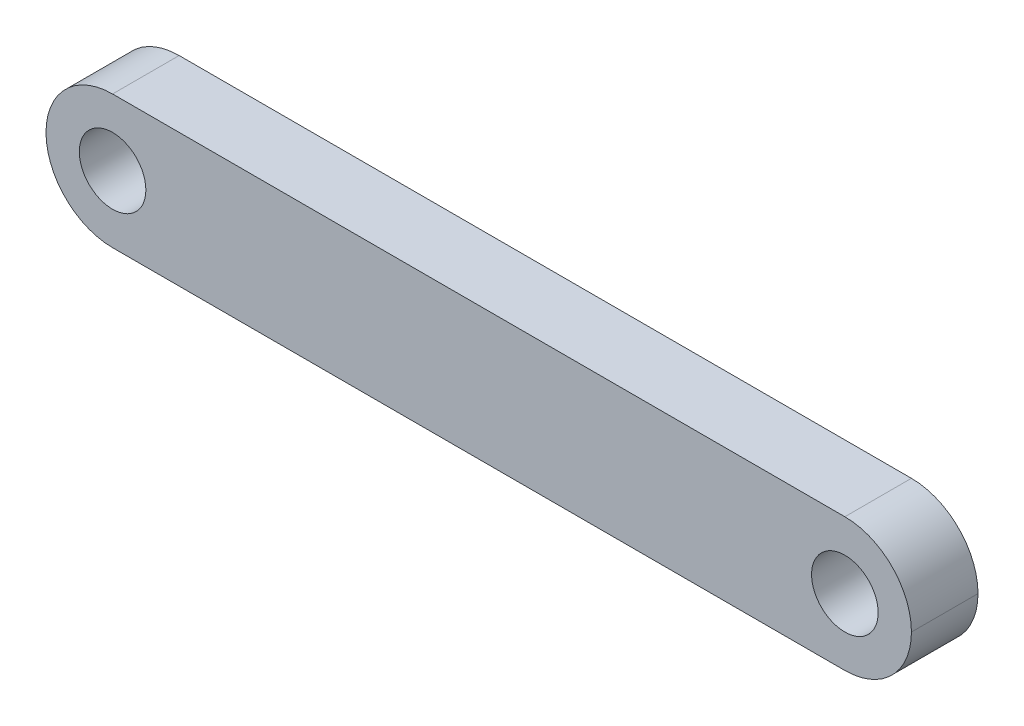
from build123d import *

# Parameters (mm, degrees)
SKETCH2_W          = 82.55
SKETCH2_H          = 12.7
CRANK_HANDLE_DEPTH = 6.35
EDGE_1_R           = 6.35
EDGE_2_R           = 6.35
EDGE_3_R           = 6.35
EDGE_4_R           = 6.35
SKETCH3_R          = 3.175
HOLES_DEPTH        = 84.762252835


with BuildPart() as part:
    # Sketch2 → Crank Handle (new body)
    with BuildSketch(Plane.XY):
        with Locations((41.275, 6.35)):
            Rectangle(SKETCH2_W, SKETCH2_H)
    extrude(amount=CRANK_HANDLE_DEPTH)

    # Edge 1
    edge_1_edges = [part.edges().sort_by_distance(p)[0] for p in [
        (82.55, 12.7, 3.175),
    ]]
    fillet(edge_1_edges, radius=EDGE_1_R)

    # Edge 2
    edge_2_edges = [part.edges().sort_by_distance(p)[0] for p in [
        (82.55, 0, 3.175),
    ]]
    fillet(edge_2_edges, radius=EDGE_2_R - 0.0001)  # a hair under: the kernel refuses the full size

    # Edge 3
    edge_3_edges = [part.edges().sort_by_distance(p)[0] for p in [
        (0, 12.7, 3.175),
    ]]
    fillet(edge_3_edges, radius=EDGE_3_R)

    # Edge 4
    edge_4_edges = [part.edges().sort_by_distance(p)[0] for p in [
        (0, 0, 3.175),
    ]]
    fillet(edge_4_edges, radius=EDGE_4_R - 0.0001)  # a hair under: the kernel refuses the full size

    # Sketch3 → Holes (cut, through all)
    with BuildSketch(Plane.XY.offset(6.35)):
        with Locations((6.35, 6.35)):
            Circle(SKETCH3_R)
        with Locations((76.2, 6.35)):
            Circle(SKETCH3_R)
    extrude(amount=-HOLES_DEPTH, mode=Mode.SUBTRACT)


solid = part.part
